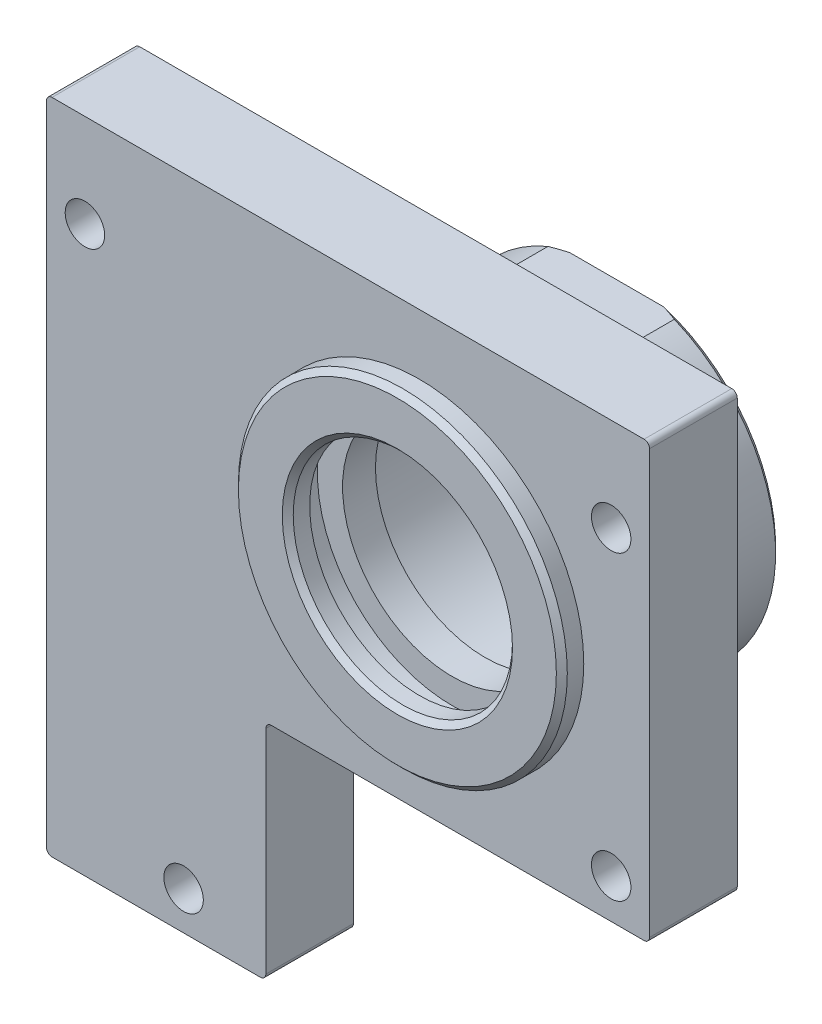
from build123d import *

# Parameters (mm, degrees)
SKETCH_1_W                       = 55
SKETCH_1_H                       = 60
EXTRUDE_1_DEPTH                  = 16.5
HOLE_WIZARD_3_6_3_6_1_D          = 3.6
HOLE_WIZARD_3_6_3_6_1_DEPTH      = 25
HOLE_WIZARD_3_6_3_6_1_TIP        = 1.081549114
HOLE_WIZARD_M2_5_1_D             = 2.05
HOLE_WIZARD_M2_5_1_DEPTH         = 14
HOLE_WIZARD_M2_5_1_TIP           = 0.615882135
SKETCH_8_W                       = 35
SKETCH_8_H                       = 20.4
CUT_EXTRUDE_1_DEPTH              = 44.914690025
CUT_EXTRUDE_START                = 2.5
SKETCH_9_W                       = 20
SKETCH_9_H                       = 6
CUT_EXTRUDE_2_DEPTH              = 42.414690025
SHELL_START                      = 1.8
SHELL_1_DEPTH                    = 14.7
EXTRUDE_2_DEPTH                  = 8
SKETCH_16_R                      = 3
CUT_EXTRUDE_4_DEPTH              = 12
CUT_EXTRUDE_5_DEPTH              = 47.599785407
CUT_EXTRUDE_5_DEPTH_BACK         = 47.599785407
SKETCH_17_R                      = 10
FILLET_1_R                       = 0.5
FILLET_2_R                       = 0.5
SKETCH_20_W                      = 1.8
SKETCH_20_H                      = 8
HOLE_WIZARD_3_6_3_6_2_AT_2_COUNT = 2
HOLE_WIZARD_3_6_3_6_2_AT_2_PITCH = 27.5
HOLE_WIZARD_3_6_3_6_2_AT_3_COUNT = 2
HOLE_WIZARD_3_6_3_6_2_AT_3_PITCH = 61.846584384
HOLE_WIZARD_3_6_3_6_2_AT_4_COUNT = 2
HOLE_WIZARD_3_6_3_6_2_AT_4_PITCH = 48
CUT_EXTRUDE_6_DEPTH              = 2
FILLET_3_R                       = 2
EXTRUDE_START                    = -8
SKETCH_24_R                      = 15
SKETCH_24_R_2                    = 10
EXTRUDE_3_DEPTH                  = 20
CHAMFER_1_SIZE                   = 0.5
CUT_EXTRUDE_START_2              = -2
SKETCH_25_R                      = 12.3
CUT_EXTRUDE_7_DEPTH              = 3
SKETCH_26_R                      = 12
CUT_EXTRUDE_8_DEPTH              = 12
SKETCH_27_W                      = 27.90091823
SKETCH_27_H                      = 2.950248151
CUT_EXTRUDE_9_DEPTH              = 12


# Read off the part's stored shape, not the designer's step: 抽壳1
with BuildPart() as part:
    # 草图1 → 凸台-拉伸1 (new body)
    with BuildSketch(Plane.XY):
        Rectangle(SKETCH_1_W, SKETCH_1_H)
    extrude(amount=EXTRUDE_1_DEPTH)

    # Ø3.6 (3.6) 直径孔1
    with Locations(Plane.XY.offset(16.5)):
        with Locations((-24, 21.5), (24, 21.5), (24, -6), (-15, -26.5)):
            Hole(HOLE_WIZARD_3_6_3_6_1_D / 2, depth=HOLE_WIZARD_3_6_3_6_1_DEPTH)
            with Locations((0, 0, -(HOLE_WIZARD_3_6_3_6_1_DEPTH + HOLE_WIZARD_3_6_3_6_1_TIP / 2))):  # 118° drill point
                Cone(0, HOLE_WIZARD_3_6_3_6_1_D / 2, HOLE_WIZARD_3_6_3_6_1_TIP, mode=Mode.SUBTRACT)

    # M2.5 螺纹孔1
    with Locations(Plane.XY.offset(16.5)):
        with Locations((-24, 26.5), (24, 26.5), (24, -1), (-22.5, -26.5)):
            Hole(HOLE_WIZARD_M2_5_1_D / 2, depth=HOLE_WIZARD_M2_5_1_DEPTH)
            with Locations((0, 0, -(HOLE_WIZARD_M2_5_1_DEPTH + HOLE_WIZARD_M2_5_1_TIP / 2))):  # 118° drill point
                Cone(0, HOLE_WIZARD_M2_5_1_D / 2, HOLE_WIZARD_M2_5_1_TIP, mode=Mode.SUBTRACT)

    # 草图8 → 切除-拉伸1 (cut, through all)
    with BuildSketch(Plane.XY.offset(16.5)):
        with Locations((10, -19.8)):
            Rectangle(SKETCH_8_W, SKETCH_8_H)
    extrude(amount=-CUT_EXTRUDE_1_DEPTH, mode=Mode.SUBTRACT)

    # 草图9 → 切除-拉伸2 (cut, through all)
    with BuildSketch(Plane(origin=(0, 0, 16.5), x_dir=(-1, 0, 0), z_dir=(0, 0, -1)).offset(CUT_EXTRUDE_START)):
        with Locations((17.5, -27)):
            Rectangle(SKETCH_9_W, SKETCH_9_H)
    extrude(amount=CUT_EXTRUDE_2_DEPTH, mode=Mode.SUBTRACT)

    # 抽壳1 outline → 抽壳1 (cut)
    with BuildSketch(Plane.XY.offset(SHELL_START)):
        with BuildLine():
            ThreePointArc((-21.743758657, 28.2), (-21.182110509, 26.299690696), (-22.006919283, 24.4979375))
            ThreePointArc((-22.006919283, 24.4979375), (-20.910890356, 19.651378458), (-25.7, 18.326673669))
            Line((-25.7, 18.326673669), (-25.7, -22.2))
            Line((-25.7, -22.2), (-9.3, -22.2))
            Line((-9.3, -22.2), (-9.3, -7.8))
            Line((-9.3, -7.8), (20.882308546, -7.8))
            ThreePointArc((20.882308546, -7.8), (20.494996561, -5.178446051), (22.006919283, -3.0020625))
            ThreePointArc((22.006919283, -3.0020625), (21.865811165, 0.8509087), (25.7, 1.256241343))
            Line((25.7, 1.256241343), (25.7, 18.326673669))
            ThreePointArc((25.7, 18.326673669), (20.910890356, 19.651378458), (22.006919283, 24.4979375))
            ThreePointArc((22.006919283, 24.4979375), (21.182110509, 26.299690696), (21.743758657, 28.2))
            Line((21.743758657, 28.2), (-21.743758657, 28.2))
        make_face()
    extrude(amount=SHELL_1_DEPTH, mode=Mode.SUBTRACT)

    # 草图16 → 切除-拉伸4 (cut)
    with BuildSketch(Plane(origin=(-7.5, 0, 0), x_dir=(0, 0, -1), z_dir=(1, 0, 0))):
        with Locations(Location((-8, -18, 0), (0, 0, 90))):
            Circle(SKETCH_16_R)
    extrude(amount=-CUT_EXTRUDE_4_DEPTH, mode=Mode.SUBTRACT)


with BuildPart() as body_2:
    # 草图10 → 凸台-拉伸2 (new body)
    with BuildSketch(Plane.XY.offset(16.5)):
        Polygon((-27.5, -30), (-7.5, -30), (-7.5, -9.6), (27.5, -9.6), (27.5, 30), (-27.5, 30), align=None)
    extrude(amount=EXTRUDE_2_DEPTH)


with BuildPart() as cut_extrude_5_tool:
    # 草图17 → 切除-拉伸5 (new, two sides: drawn at the far end of the back side and taken through both)
    with BuildSketch(Plane.XY.offset(1.8).offset(-CUT_EXTRUDE_5_DEPTH_BACK)):
        with Locations((6.5, 9.5)):
            Circle(SKETCH_17_R)
    extrude(amount=CUT_EXTRUDE_5_DEPTH + CUT_EXTRUDE_5_DEPTH_BACK)


with BuildPart() as part_1:
    add(part.part)

    # 切除-拉伸5: cut by cut_extrude_5_tool
    add(cut_extrude_5_tool.part, mode=Mode.SUBTRACT)

    # 圆角1
    fillet_1_edges = [part_1.edges().sort_by_distance(p)[0] for p in [
        (-27.5, 3, 0),
        (0, 30, 0),
        (27.5, 10.2, 0),
        (27.5, -9.6, 8.25),
        (-7.5, -16.8, 0),
        (10, -9.6, 0),
        (-7.5, -9.6, 8.25),
        (-7.5, -30, 15.25),
        (-27.5, -30, 15.25),
        (-27.5, 30, 8.25),
        (27.5, 30, 8.25),
        (-17.5, -24, 0),
        (-7.5, -24, 7),
        (-27.5, -24, 7),
    ]]
    fillet(fillet_1_edges, radius=FILLET_1_R)


with BuildPart() as body_2_1:
    add(body_2.part)

    # 切除-拉伸5: cut by cut_extrude_5_tool
    add(cut_extrude_5_tool.part, mode=Mode.SUBTRACT)

    # 圆角2
    fillet_2_edges = [body_2_1.edges().sort_by_distance(p)[0] for p in [
        (-27.5, 30, 20.5),
        (27.5, 30, 20.5),
        (27.5, -9.6, 20.5),
        (-7.5, -9.6, 20.5),
        (-7.5, -30, 20.5),
        (-27.5, -30, 20.5),
    ]]
    fillet(fillet_2_edges, radius=FILLET_2_R)

    # 草图20 → Ø3.6 (3.6) 直径孔2 (revolve, cut)
    with BuildSketch(Plane(origin=(24, 21.5, 16.5), x_dir=(0, 1, 0), z_dir=(1, 0, 0))):
        with Locations((0.9, 4)):
            Rectangle(SKETCH_20_W, SKETCH_20_H)
    hole_wizard_3_6_3_6_2 = revolve(axis=Axis((24, 21.5, 10.15), (0, 0, 1)), mode=Mode.SUBTRACT)

    # Ø3.6 (3.6) 直径孔2 at 2: Ø3.6 (3.6) 直径孔2 ×2
    with Locations(*[(0, -i * HOLE_WIZARD_3_6_3_6_2_AT_2_PITCH, 0) for i in range(1, HOLE_WIZARD_3_6_3_6_2_AT_2_COUNT)]):
        add(hole_wizard_3_6_3_6_2, mode=Mode.SUBTRACT)

    # Ø3.6 (3.6) 直径孔2 at 3: Ø3.6 (3.6) 直径孔2 ×2
    with Locations(*[Vector(-0.6305926250944656, -0.7761140001162656, 0) * (i * HOLE_WIZARD_3_6_3_6_2_AT_3_PITCH) for i in range(1, HOLE_WIZARD_3_6_3_6_2_AT_3_COUNT)]):
        add(hole_wizard_3_6_3_6_2, mode=Mode.SUBTRACT)

    # Ø3.6 (3.6) 直径孔2 at 4: Ø3.6 (3.6) 直径孔2 ×2
    with Locations(*[(-i * HOLE_WIZARD_3_6_3_6_2_AT_4_PITCH, 0, 0) for i in range(1, HOLE_WIZARD_3_6_3_6_2_AT_4_COUNT)]):
        add(hole_wizard_3_6_3_6_2, mode=Mode.SUBTRACT)

    # 草图23 → 切除-拉伸6 (cut)
    with BuildSketch(Plane(origin=(0, 0, 16.5), x_dir=(-1, 0, 0), z_dir=(0, 0, -1))):
        with BuildLine():
            Line((8.25, -10.1), (8.25, -29.25))
            Line((8.25, -29.25), (26.75, -29.25))
            Line((26.75, -29.25), (26.75, 29.25))
            Line((26.75, 29.25), (-26.75, 29.25))
            Line((-26.75, 29.25), (-26.75, -8.85))
            Line((-26.75, -8.85), (7, -8.85))
            ThreePointArc((7, -8.85), (7.883883476, -9.216116524), (8.25, -10.1))
        make_face()
    extrude(amount=-CUT_EXTRUDE_6_DEPTH, mode=Mode.SUBTRACT)

    # 圆角3
    fillet_3_edges = [body_2_1.edges().sort_by_distance(p)[0] for p in [
        (26.75, -8.85, 17.5),
        (26.75, 29.25, 17.5),
        (-26.75, 29.25, 17.5),
        (-26.75, -29.25, 17.5),
        (-8.25, -29.25, 17.5),
    ]]
    fillet(fillet_3_edges, radius=FILLET_3_R)

    # 草图24 → 凸台-拉伸3 (add)
    with BuildSketch(Plane(origin=(0, 0, 18.5), x_dir=(-1, 0, 0), z_dir=(0, 0, -1)).offset(EXTRUDE_START)):
        with Locations((-6.5, 9.5)):
            Circle(SKETCH_24_R)
        with Locations((-6.5, 9.5)):
            Circle(SKETCH_24_R_2, mode=Mode.SUBTRACT)
    extrude(amount=EXTRUDE_3_DEPTH)

    # 倒角1
    chamfer_1_edges = [body_2_1.edges().sort_by_distance(p)[0] for p in [
        (21.5, 9.5, 26.5),
        (21.5, 9.5, 6.5),
        (16.5, 9.5, 26.5),
    ]]
    chamfer(chamfer_1_edges, length=CHAMFER_1_SIZE)

    # 草图25 → 切除-拉伸7 (cut)
    with BuildSketch(Plane.XY.offset(26.5).offset(CUT_EXTRUDE_START_2)):
        with Locations((6.5, 9.5)):
            Circle(SKETCH_25_R)
    extrude(amount=-CUT_EXTRUDE_7_DEPTH, mode=Mode.SUBTRACT)

    # 草图26 → 切除-拉伸8 (cut)
    with BuildSketch(Plane(origin=(0, 0, 6.5), x_dir=(-1, 0, 0), z_dir=(0, 0, -1))):
        with Locations((-6.5, 9.5)):
            Circle(SKETCH_26_R)
    extrude(amount=-CUT_EXTRUDE_8_DEPTH, mode=Mode.SUBTRACT)

    # 草图27 → 切除-拉伸9 (cut)
    with BuildSketch(Plane(origin=(0, 0, 6.5), x_dir=(-1, 0, 0), z_dir=(0, 0, -1))):
        with Locations((-4.79900427, -5.825124076)):
            Rectangle(SKETCH_27_W, SKETCH_27_H)
        with Locations((-4.79900427, 24.825124075)):
            Rectangle(SKETCH_27_W, SKETCH_27_H)
    extrude(amount=-CUT_EXTRUDE_9_DEPTH, mode=Mode.SUBTRACT)


solid = body_2_1.part
